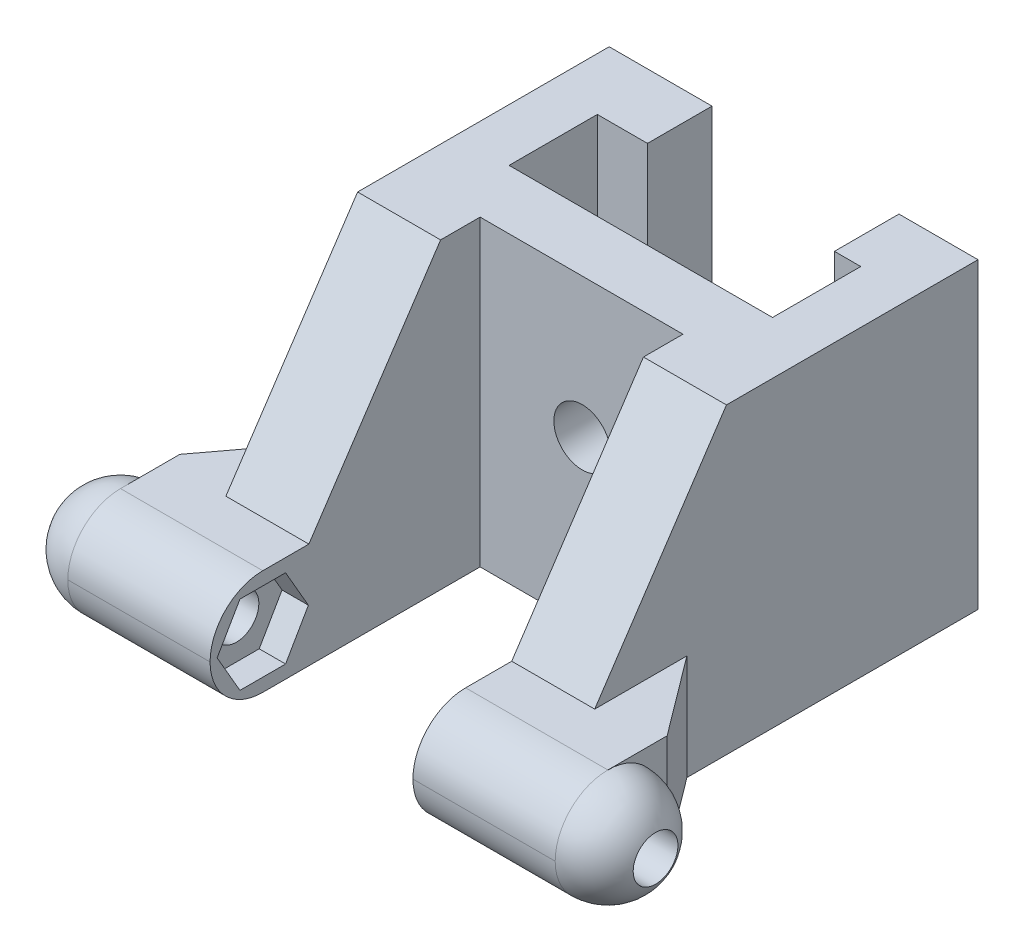
from build123d import *

# Parameters (mm, degrees)
BOSS_EXTRUDE1_DEPTH      = 8
BOSS_EXTRUDE2_DEPTH      = 15
BOSS_EXTRUDE4_DEPTH      = 6.3
BOSS_EXTRUDE5_DEPTH      = 6.3
SKETCH7_R                = 1.7
ENL_V_MAT_EXTRU_14_DEPTH = 62.473571557
SKETCH8_W                = 5.8
SKETCH8_H                = 18
BOSS_EXTRU_3_DEPTH       = 0.5
ESQUISSE5_R              = 2.15
ENL_V_MAT_EXTRU_5_DEPTH  = 48.765049984
ESQUISSE9_W              = 28
ESQUISSE9_H              = 5.300857061
ENL_V_MAT_EXTRU_9_DEPTH  = 56.554027757
BOSS_EXTRU_4_DEPTH       = 1
ESQUISSE11_W             = 5.8
ESQUISSE11_H             = 1
BOSS_EXTRU_5_DEPTH       = 1
ESQUISSE14_W             = 6
ESQUISSE14_H             = 5.9
ESQUISSE14_W_2           = 9
BOSS_EXTRU_7_DEPTH       = 23
ESQUISSE15_W             = 0.6
ESQUISSE15_H             = 2
ENL_V_MAT_EXTRU_12_DEPTH = 5.8
ESQUISSE17_W             = 1.2
ESQUISSE17_H             = 5.9
ENL_V_MAT_EXTRU_13_DEPTH = 27
ESQUISSE16_W             = 28
ESQUISSE16_H             = 1
ENL_V_MAT_EXTRU_11_DEPTH = 23
CONG_3_R                 = 4
ENL_V_MAT_EXTRU_15_DEPTH = 2
ENL_V_MAT_EXTRU_16_DEPTH = 2
BOSS_EXTRU_8_DEPTH       = 8


with BuildPart() as part:
    # Sketch1 → Boss-Extrude1 (new body)
    with BuildSketch(Plane(origin=(0, 0, 0), x_dir=(1, 0, 0), z_dir=(0, 1, 0))):
        Polygon((6.3, 0), (6.3, 20.5), (12.5, 20.5), (15.5, 20.5), (21.7, 20.5), (21.7, 0), (28, 0), (36.5, 0), (36.5, 8.5), (28, 8.5), (28, 35), (22, 35), (22, 32), (24, 32), (24, 25), (4, 25), (4, 32), (8, 32), (8, 35), (0, 35), (0, 8.5), (-8.5, 8.5), (-8.5, 0), (0, 0), align=None)
    extrude(amount=BOSS_EXTRUDE1_DEPTH)

    # Sketch2 → Boss-Extrude2 (add)
    with BuildSketch(Plane(origin=(0, 8, 0), x_dir=(1, 0, 0), z_dir=(0, 1, 0))):
        Polygon((8, 35), (8, 32), (4, 32), (4, 25), (24, 25), (24, 32), (22, 32), (22, 35), (28, 35), (28, 20.5), (0, 20.5), (0, 35), align=None)
    extrude(amount=BOSS_EXTRUDE2_DEPTH)

    # Sketch4 → Boss-Extrude4 (add)
    with BuildSketch(Plane.ZY):
        Polygon((-17.5, 23), (-20.5, 23), (-20.5, 8), (-7.5, 8), align=None)
    extrude(amount=-BOSS_EXTRUDE4_DEPTH)

    # Sketch5 → Boss-Extrude5 (add)
    with BuildSketch(Plane(origin=(28, 0, 0), x_dir=(0, 0, -1), z_dir=(1, 0, 0))):
        Polygon((20.5, 8), (7.5, 8), (17.5, 23), (20.5, 23), align=None)
    extrude(amount=-BOSS_EXTRUDE5_DEPTH)

    # Sketch7 → Enlèv. mat.-Extru.14 (cut, through all)
    with BuildSketch(Plane.ZY.offset(8.5)):
        with Locations((-4, 4)):
            Circle(SKETCH7_R)
    extrude(amount=-ENL_V_MAT_EXTRU_14_DEPTH, mode=Mode.SUBTRACT)

    # Sketch8 → Boss.-Extru.3 (add)
    with BuildSketch(Plane(origin=(0, 0, -25), x_dir=(-1, 0, 0), z_dir=(0, 0, -1))):
        with Locations((-14, 9.000007445)):
            Rectangle(SKETCH8_W, SKETCH8_H)
    extrude(amount=BOSS_EXTRU_3_DEPTH)

    # Esquisse5 → Enlèv. mat.-Extru.5 (cut, through all)
    with BuildSketch(Plane.XY.offset(-20.5)):
        with Locations((14.05, 12.4)):
            Circle(ESQUISSE5_R)
    extrude(amount=-ENL_V_MAT_EXTRU_5_DEPTH, mode=Mode.SUBTRACT)

    # Esquisse9 → Enlèv. mat.-Extru.9 (cut, through all)
    with BuildSketch(Plane(origin=(0, 23, 0), x_dir=(1, 0, 0), z_dir=(0, 1, 0))):
        with Locations((14, 34.349571469)):
            Rectangle(ESQUISSE9_W, ESQUISSE9_H)
    extrude(amount=-ENL_V_MAT_EXTRU_9_DEPTH, mode=Mode.SUBTRACT)

    # Esquisse10 → Boss.-Extru.4 (add)
    with BuildSketch(Plane(origin=(0, 0, -25.5), x_dir=(-1, 0, 0), z_dir=(0, 0, -1))):
        Polygon((-16.9, 7.445e-06), (-11.1, 0), (-11.1, 6.800007445), (-16.9, 6.800007445), align=None)
    extrude(amount=BOSS_EXTRU_4_DEPTH)

    # Esquisse11 → Boss.-Extru.5 (add)
    with BuildSketch(Plane(origin=(0, 0, -25), x_dir=(-1, 0, 0), z_dir=(0, 0, -1))):
        with Locations((-14, 18.500007445)):
            Rectangle(ESQUISSE11_W, ESQUISSE11_H)
    extrude(amount=BOSS_EXTRU_5_DEPTH)

    # Esquisse14 → Boss.-Extru.7 (add)
    with BuildSketch(Plane(origin=(0, 23, -10.399142939), x_dir=(-1, 0, 0), z_dir=(0, -1, 0))):
        with Locations((-25, 24.25)):
            Rectangle(ESQUISSE14_W, ESQUISSE14_H)
        with Locations((-4.5, 24.25)):
            Rectangle(ESQUISSE14_W_2, ESQUISSE14_H)
    extrude(amount=BOSS_EXTRU_7_DEPTH)

    # Esquisse15 → Enlèv. mat.-Extru.12 (cut)
    with BuildSketch(Plane(origin=(0, 0, -37.599142939), x_dir=(-1, 0, 0), z_dir=(0, 0, -1))):
        with Locations((-7.5, 17)):
            Rectangle(ESQUISSE15_W, ESQUISSE15_H)
        with Locations((-6.6, 17)):
            Rectangle(ESQUISSE15_W, ESQUISSE15_H)
        with Locations((-5.7, 17)):
            Rectangle(ESQUISSE15_W, ESQUISSE15_H)
        with Locations((-8.4, 17)):
            Rectangle(ESQUISSE15_W, ESQUISSE15_H)
        with Locations((-8.4, 6)):
            Rectangle(ESQUISSE15_W, ESQUISSE15_H)
        with Locations((-0.3, 6)):
            Rectangle(ESQUISSE15_W, ESQUISSE15_H)
        with Locations((-0.3, 17)):
            Rectangle(ESQUISSE15_W, ESQUISSE15_H)
        with Locations((-4.8, 17)):
            Rectangle(ESQUISSE15_W, ESQUISSE15_H)
        with Locations((-3.9, 17)):
            Rectangle(ESQUISSE15_W, ESQUISSE15_H)
        with Locations((-7.5, 6)):
            Rectangle(ESQUISSE15_W, ESQUISSE15_H)
        with Locations((-3, 17)):
            Rectangle(ESQUISSE15_W, ESQUISSE15_H)
        with Locations((-2.1, 17)):
            Rectangle(ESQUISSE15_W, ESQUISSE15_H)
        with Locations((-6.6, 6)):
            Rectangle(ESQUISSE15_W, ESQUISSE15_H)
        with Locations((-1.2, 17)):
            Rectangle(ESQUISSE15_W, ESQUISSE15_H)
        with Locations((-5.7, 6)):
            Rectangle(ESQUISSE15_W, ESQUISSE15_H)
        with Locations((-4.8, 6)):
            Rectangle(ESQUISSE15_W, ESQUISSE15_H)
        with Locations((-3.9, 6)):
            Rectangle(ESQUISSE15_W, ESQUISSE15_H)
        with Locations((-3, 6)):
            Rectangle(ESQUISSE15_W, ESQUISSE15_H)
        with Locations((-2.1, 6)):
            Rectangle(ESQUISSE15_W, ESQUISSE15_H)
        with Locations((-1.2, 6)):
            Rectangle(ESQUISSE15_W, ESQUISSE15_H)
    extrude(amount=-ENL_V_MAT_EXTRU_12_DEPTH, mode=Mode.SUBTRACT)

    # Esquisse17 → Enlèv. mat.-Extru.13 (cut)
    with BuildSketch(Plane(origin=(0, 23, 0), x_dir=(1, 0, 0), z_dir=(0, 1, 0))):
        with Locations((8.407063975, 34.649142939)):
            Rectangle(ESQUISSE17_W, ESQUISSE17_H)
    extrude(amount=-ENL_V_MAT_EXTRU_13_DEPTH, mode=Mode.SUBTRACT)

    # Esquisse16 → Enlèv. mat.-Extru.11 (cut)
    with BuildSketch(Plane(origin=(0, 23, 0), x_dir=(1, 0, 0), z_dir=(0, 1, 0))):
        with Locations((14, 37.099142939)):
            Rectangle(ESQUISSE16_W, ESQUISSE16_H)
    extrude(amount=-ENL_V_MAT_EXTRU_11_DEPTH, mode=Mode.SUBTRACT)

    # Esquisse23 → Enlèvement de matière-Révolution11 (revolve, cut)
    with BuildSketch(Plane(origin=(0, 0, -4), x_dir=(-1, 0, 0), z_dir=(0, 0, -1)), mode=Mode.PRIVATE) as enl_vement_de_mati_re_r_volution11_sk:
        with BuildLine():
            Line((-32.5, 8), (-32.5, 11.823143252))
            Line((-32.5, 11.823143252), (-33.950094463, 11.823143252))
            Line((-33.950094463, 11.823143252), (-37.601757894, 11.944869061))
            Line((-37.601757894, 11.944869061), (-40.320792242, 4))
            Line((-40.320792242, 4), (-36.5, 4))
            ThreePointArc((-36.5, 4), (-35.328427125, 6.828427125), (-32.5, 8))
        make_face()
        with BuildLine():
            Line((8.5, 4), (12.320792242, 4))
            Line((12.320792242, 4), (9.601757894, 11.944869061))
            Line((9.601757894, 11.944869061), (5.950094463, 11.823143252))
            Line((5.950094463, 11.823143252), (4.5, 11.823143252))
            Line((4.5, 11.823143252), (4.5, 8))
            ThreePointArc((4.5, 8), (7.328427125, 6.828427125), (8.5, 4))
        make_face()
    revolve(enl_vement_de_mati_re_r_volution11_sk.sketch.rotate(Axis((36.5, 4, -4), (1, 0, 0)), 90), axis=Axis((36.5, 4, -4), (1, 0, 0)), mode=Mode.SUBTRACT)

    # Congé3
    cong_3_edges = [part.edges().sort_by_distance(p)[0] for p in [
        (27.1, 0, 0),
        (27.1, 8, 0),
        (0.9, 0, 0),
        (0.9, 8, 0),
    ]]
    fillet(cong_3_edges, radius=CONG_3_R - 0.0001)  # a hair under: the kernel refuses the full size

    # Esquisse26 → Enlèv. mat.-Extru.15 (cut)
    with BuildSketch(Plane.ZY.offset(-21.7)):
        Polygon((-0.535898385, 4), (-2.267949192, 7), (-5.732050808, 7), (-7.464101615, 4), (-5.732050808, 1), (-2.267949192, 1), align=None)
    extrude(amount=-ENL_V_MAT_EXTRU_15_DEPTH, mode=Mode.SUBTRACT)

    # Esquisse27 → Enlèv. mat.-Extru.16 (cut)
    with BuildSketch(Plane(origin=(6.3, 0, 0), x_dir=(0, 0, -1), z_dir=(1, 0, 0))):
        Polygon((7.464101615, 4), (5.732050808, 7), (2.267949192, 7), (0.535898385, 4), (2.267949192, 1), (5.732050808, 1), align=None)
    extrude(amount=-ENL_V_MAT_EXTRU_16_DEPTH, mode=Mode.SUBTRACT)

    # Esquisse28 → Boss.-Extru.8 (add)
    with BuildSketch(Plane(origin=(0, 8, 0), x_dir=(1, 0, 0), z_dir=(0, 1, 0))):
        Polygon((28, 8.5), (32.5, 8.5), (28, 14.5), align=None)
        Polygon((-4.5, 8.5), (0, 14.5), (0, 8.5), align=None)
    extrude(amount=-BOSS_EXTRU_8_DEPTH)


solid = part.part
